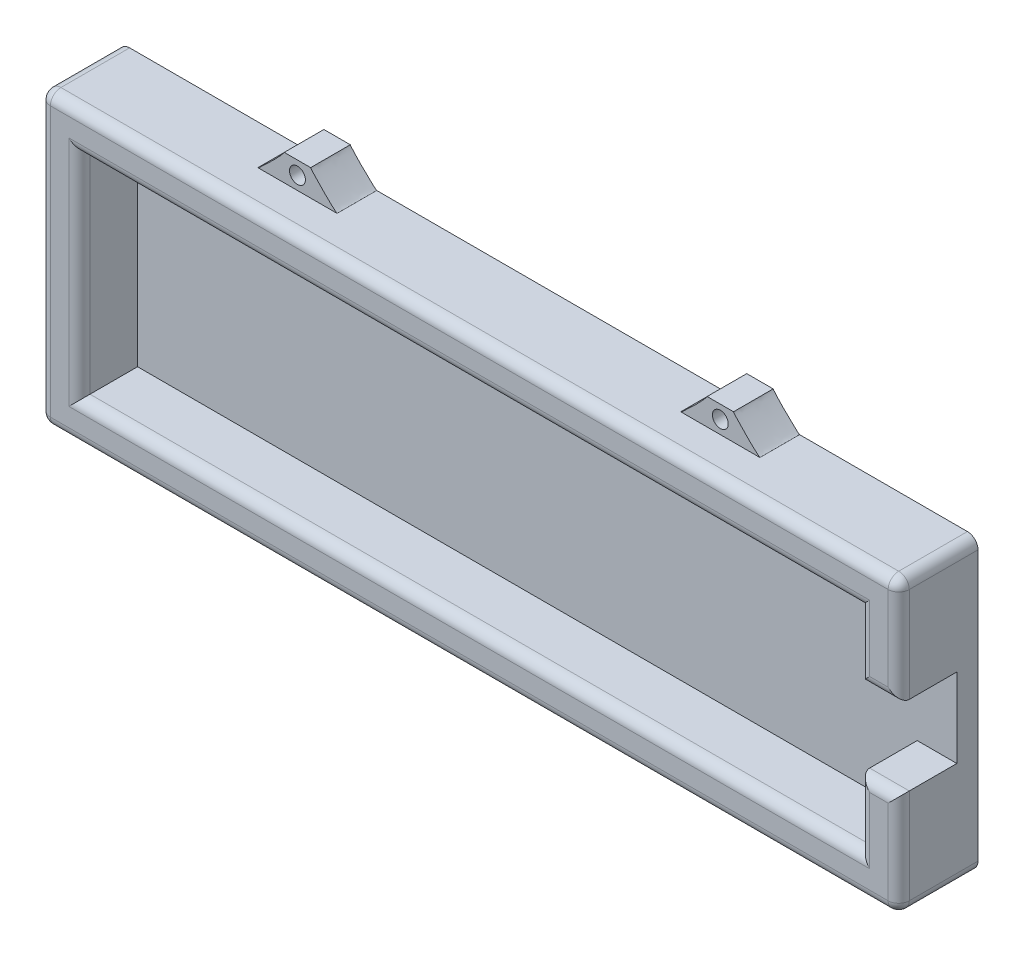
from build123d import *

# Parameters (mm, degrees)
SCHIZZO1_W                   = 325
SCHIZZO1_H                   = 110
ESTRUSIONE_ESTRUSIONE1_DEPTH = 30
SCHIZZO2_W                   = 15
SCHIZZO2_H                   = 30
SCHIZZO2_W_2                 = 295
SCHIZZO2_H_2                 = 80
TAGLIO_ESTRUSIONE1_DEPTH     = 22
ESTRUSIONE_ESTRUSIONE2_START = -15
SCHIZZO3_W                   = 10
SCHIZZO3_H                   = 10
SCHIZZO3_R                   = 3
ESTRUSIONE_ESTRUSIONE2_DEPTH = 15
RACCORDO1_DEPTH              = 15
RACCORDO2_R                  = 4


with BuildPart() as part:
    # Schizzo1 → Estrusione-Estrusione1 (new body)
    with BuildSketch(Plane.XY):
        Rectangle(SCHIZZO1_W, SCHIZZO1_H)
    extrude(amount=ESTRUSIONE_ESTRUSIONE1_DEPTH)

    # Schizzo2 → Taglio-Estrusione1 (cut)
    with BuildSketch(Plane.XY.offset(30)):
        with Locations((155, 0)):
            Rectangle(SCHIZZO2_W, SCHIZZO2_H)
        Rectangle(SCHIZZO2_W_2, SCHIZZO2_H_2)
    extrude(amount=-TAGLIO_ESTRUSIONE1_DEPTH, mode=Mode.SUBTRACT)

    # Schizzo3 → Estrusione-Estrusione2 (add)
    # profile 1 of 4: a face of its own
    with BuildSketch(Plane.XY.offset(30).offset(ESTRUSIONE_ESTRUSIONE2_START)):
        with Locations((-80, 60)):
            Rectangle(SCHIZZO3_W, SCHIZZO3_H)
        with Locations((-80, 60)):
            Circle(SCHIZZO3_R, mode=Mode.SUBTRACT)
    # profile 2 of 4: a face of its own
    with BuildSketch(Plane.XY.offset(30).offset(ESTRUSIONE_ESTRUSIONE2_START)):
        with Locations((80, 60)):
            Rectangle(SCHIZZO3_W, SCHIZZO3_H)
        with Locations((80, 60)):
            Circle(SCHIZZO3_R, mode=Mode.SUBTRACT)
    # profile 3 of 4: a face of its own
    with BuildSketch(Plane.XY.offset(30).offset(ESTRUSIONE_ESTRUSIONE2_START)):
        with Locations((80, -60)):
            Rectangle(SCHIZZO3_W, SCHIZZO3_H)
        with Locations((80, -60)):
            Circle(SCHIZZO3_R, mode=Mode.SUBTRACT)
    # profile 4 of 4: a face of its own
    with BuildSketch(Plane.XY.offset(30).offset(ESTRUSIONE_ESTRUSIONE2_START)):
        with Locations((-80, -60)):
            Rectangle(SCHIZZO3_W, SCHIZZO3_H)
        with Locations((-80, -60)):
            Circle(SCHIZZO3_R, mode=Mode.SUBTRACT)
    extrude(amount=-ESTRUSIONE_ESTRUSIONE2_DEPTH)

    # Raccordo1: read off the stored shape, not the designer's step
    # Raccordo1 outline → Raccordo1 (add)
    with BuildSketch(Plane.XY):
        with BuildLine():
            Line((85, 55), (95, 55))
            add(Edge.make_bspline(
                [(95, 55), (85, 55), (85, 65)],
                knots=[0, 0, 0, 1, 1, 1], degree=2, weights=[1, 0.052631579, 1]))
            Line((85, 65), (85, 55))
        make_face()
        with BuildLine():
            Line((-95, 55), (-85, 55))
            Line((-85, 55), (-85, 65))
            add(Edge.make_bspline(
                [(-85, 65), (-85, 55), (-95, 55)],
                knots=[0, 0, 0, 1, 1, 1], degree=2, weights=[1, 0.052631579, 1]))
        make_face()
        with BuildLine():
            Line((-75, 55), (-65, 55))
            add(Edge.make_bspline(
                [(-65, 55), (-75, 55), (-75, 65)],
                knots=[0, 0, 0, 1, 1, 1], degree=2, weights=[1, 0.052631579, 1]))
            Line((-75, 65), (-75, 55))
        make_face()
        with BuildLine():
            Line((65, 55), (75, 55))
            Line((75, 55), (75, 65))
            add(Edge.make_bspline(
                [(75, 65), (75, 55), (65, 55)],
                knots=[0, 0, 0, 1, 1, 1], degree=2, weights=[1, 0.052631579, 1]))
        make_face()
        with BuildLine():
            Line((75, -55), (65, -55))
            add(Edge.make_bspline(
                [(65, -55), (75, -55), (75, -65)],
                knots=[0, 0, 0, 1, 1, 1], degree=2, weights=[1, 0.052631579, 1]))
            Line((75, -65), (75, -55))
        make_face()
        with BuildLine():
            Line((95, -55), (85, -55))
            Line((85, -55), (85, -65))
            add(Edge.make_bspline(
                [(85, -65), (85, -55), (95, -55)],
                knots=[0, 0, 0, 1, 1, 1], degree=2, weights=[1, 0.052631579, 1]))
        make_face()
        with BuildLine():
            Line((-85, -65), (-85, -55))
            Line((-85, -55), (-95, -55))
            add(Edge.make_bspline(
                [(-95, -55), (-85, -55), (-85, -65)],
                knots=[0, 0, 0, 1, 1, 1], degree=2, weights=[1, 0.052631579, 1]))
        make_face()
        with BuildLine():
            add(Edge.make_bspline(
                [(-75, -65), (-75, -55), (-65, -55)],
                knots=[0, 0, 0, 1, 1, 1], degree=2, weights=[1, 0.052631579, 1]))
            Line((-65, -55), (-75, -55))
            Line((-75, -55), (-75, -65))
        make_face()
    extrude(amount=RACCORDO1_DEPTH)

    # Raccordo2
    raccordo2_edges = [part.edges().sort_by_distance(p)[0] for p in [
        (0, 40, 30),
        (-147.5, 0, 30),
        (0, -40, 30),
        (147.5, -27.5, 30),
        (155, -15, 30),
        (162.5, -35, 30),
        (0, -55, 30),
        (-162.5, 0, 30),
        (0, 55, 30),
        (162.5, 35, 30),
        (155, 15, 30),
        (147.5, 27.5, 30),
        (-162.5, 55, 15),
        (-162.5, -55, 15),
        (162.5, -55, 15),
        (162.5, 55, 15),
    ]]
    fillet(raccordo2_edges, radius=RACCORDO2_R)


solid = part.part
